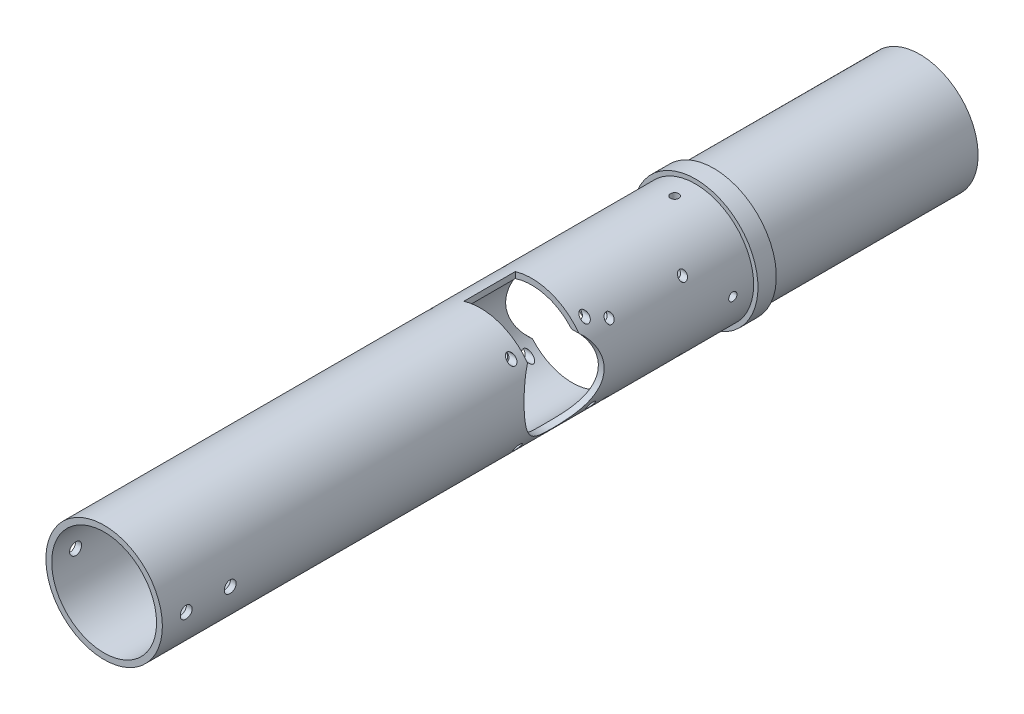
from build123d import *

# Parameters (mm, degrees)
BOSS_EXTRUDE1_DEPTH           = 125
BOSS_EXTRUDE1_DEPTH_BACK      = 250
SKETCH1_R                     = 31.75
SKETCH1_R_2                   = 28.575
SKETCH2_R                     = 21.75
CUT_EXTRUDE1_DEPTH            = 255.000246063
SKETCH3_R                     = 21.75
CUT_EXTRUDE2_DEPTH            = 255.000246187
CUT_EXTRUDE4_START            = 9
SKETCH5_W                     = 28
SKETCH5_H                     = 22
CUT_EXTRUDE4_DEPTH            = 264.000246187
CUT_EXTRUDE5_START            = -9
SKETCH6_W                     = 28
SKETCH6_H                     = 22
CUT_EXTRUDE5_DEPTH            = 264.000246187
CUT_EXTRUDE8_DEPTH            = 255.000246187
CUT_EXTRUDE8_DEPTH_BACK       = 255.000246187
SKETCH11_R                    = 2
CUT_EXTRUDE10_DEPTH           = 255.000246187
CUT_EXTRUDE10_DEPTH_BACK      = 255.000246187
SKETCH12_R                    = 3.25
CUT_EXTRUDE12_DEPTH           = 255.000246187
CUT_EXTRUDE12_DEPTH_BACK      = 255.000246187
SKETCH15_R                    = 2
SKETCH19_W                    = 2.25
SKETCH19_H                    = 31.75
M4_CLEARANCE_HOLE1_AT_2_COUNT = 2
M4_CLEARANCE_HOLE1_AT_2_PITCH = 40
M4_CLEARANCE_HOLE1_AT_3_COUNT = 2
M4_CLEARANCE_HOLE1_AT_3_PITCH = 40
M4_CLEARANCE_HOLE1_AT_4_COUNT = 2
M4_CLEARANCE_HOLE1_AT_4_PITCH = 56.568542495
M4_CLEARANCE_HOLE1_AT_5_COUNT = 2
M4_CLEARANCE_HOLE1_AT_5_PITCH = 90.126807577
M4_CLEARANCE_HOLE1_AT_6_COUNT = 2
M4_CLEARANCE_HOLE1_AT_6_PITCH = 50.197623888
M4_CLEARANCE_HOLE1_AT_7_COUNT = 2
M4_CLEARANCE_HOLE1_AT_7_PITCH = 100.213978286
M4_CLEARANCE_HOLE1_AT_8_COUNT = 2
M4_CLEARANCE_HOLE1_AT_8_PITCH = 66.631835064
MIRROR1_COPY_1_SKETCH_W       = 2.25
MIRROR1_COPY_1_SKETCH_H       = 31.75
MIRROR1_COPY_2_SKETCH_W       = 2.25
MIRROR1_COPY_2_SKETCH_H       = 31.75
MIRROR1_COPY_3_SKETCH_W       = 2.25
MIRROR1_COPY_3_SKETCH_H       = 31.75
MIRROR1_COPY_4_SKETCH_W       = 2.25
MIRROR1_COPY_4_SKETCH_H       = 31.75
MIRROR1_COPY_5_SKETCH_W       = 2.25
MIRROR1_COPY_5_SKETCH_H       = 31.75
MIRROR1_COPY_6_SKETCH_W       = 2.25
MIRROR1_COPY_6_SKETCH_H       = 31.75
MIRROR1_COPY_7_SKETCH_W       = 2.25
MIRROR1_COPY_7_SKETCH_H       = 31.75
SKETCH21_R                    = 30
CUT_EXTRUDE14_DEPTH           = 7
SKETCH22_R                    = 2.25
CUT_EXTRUDE15_DEPTH           = 255.000246187
SKETCH23_R                    = 30
SKETCH23_R_2                  = 28.575
BOSS_EXTRUDE2_DEPTH           = 7
CIRPATTERN2_COUNT             = 4
SKETCH24_R                    = 31.75
SKETCH24_R_2                  = 28.575
BOSS_EXTRUDE3_DEPTH           = 70.65
SKETCH25_R                    = 31.75
CUT_EXTRUDE16_DEPTH           = 1
BOSS_EXTRUDE4_START           = 10
SKETCH26_R                    = 34.1
SKETCH26_R_2                  = 31.75
BOSS_EXTRUDE4_DEPTH           = 10
BOSS_EXTRUDE5_START           = -10
SKETCH29_R                    = 28.575
SKETCH29_R_2                  = 21
BOSS_EXTRUDE5_DEPTH           = 10
M4X0_7_TAPPED_HOLE1_D         = 3.3
CIRPATTERN3_COUNT             = 8


with BuildPart() as part:
    # Sketch1 → Boss-Extrude1 (new, two sides: drawn at the far end of the back side and taken through both)
    with BuildSketch(Plane.XY.offset(-BOSS_EXTRUDE1_DEPTH_BACK)):
        Circle(SKETCH1_R)
        Circle(SKETCH1_R_2, mode=Mode.SUBTRACT)
    extrude(amount=BOSS_EXTRUDE1_DEPTH + BOSS_EXTRUDE1_DEPTH_BACK)

    # Sketch2 → Cut-Extrude1 (cut, through all)
    with BuildSketch(Plane(origin=(0, 0, 0), x_dir=(0, 0, -1), z_dir=(1, 0, 0))):
        with Locations((73.488, -2)):
            Circle(SKETCH2_R)
    extrude(amount=-CUT_EXTRUDE1_DEPTH, mode=Mode.SUBTRACT)

    # Sketch3 → Cut-Extrude2 (cut, through all)
    with BuildSketch(Plane(origin=(0, 0, 0), x_dir=(0, 0, -1), z_dir=(1, 0, 0))):
        with Locations(Location((23.45, 2, 0), (0, 0, 354.723969399))):
            Circle(SKETCH3_R)
    extrude(amount=CUT_EXTRUDE2_DEPTH, mode=Mode.SUBTRACT)

    # Sketch5 → Cut-Extrude4 (cut, through all)
    with BuildSketch(Plane(origin=(0, 0, 0), x_dir=(0, 0, -1), z_dir=(1, 0, 0)).offset(CUT_EXTRUDE4_START)):
        with Locations((73.488, -23.75)):
            Rectangle(SKETCH5_W, SKETCH5_H)
    extrude(amount=-CUT_EXTRUDE4_DEPTH, mode=Mode.SUBTRACT)

    # Sketch6 → Cut-Extrude5 (cut, through all)
    with BuildSketch(Plane(origin=(0, 0, 0), x_dir=(0, 0, -1), z_dir=(1, 0, 0)).offset(CUT_EXTRUDE5_START)):
        with Locations((23.45, 23.75)):
            Rectangle(SKETCH6_W, SKETCH6_H)
    extrude(amount=CUT_EXTRUDE5_DEPTH, mode=Mode.SUBTRACT)

    # Sketch11 → Cut-Extrude8 (cut, two sides: drawn at the far end of the back side and taken through both)
    with BuildSketch(Plane(origin=(0, 0, 0), x_dir=(0, 0, -1), z_dir=(1, 0, 0)).offset(-CUT_EXTRUDE8_DEPTH_BACK)):
        with Locations((93.488, 18)):
            Circle(SKETCH11_R)
        with Locations((53.488, 18)):
            Circle(SKETCH11_R)
        with Locations((53.488, -22)):
            Circle(SKETCH11_R)
        with Locations((93.488, -22)):
            Circle(SKETCH11_R)
    extrude(amount=CUT_EXTRUDE8_DEPTH + CUT_EXTRUDE8_DEPTH_BACK, mode=Mode.SUBTRACT)

    # Sketch12 → Cut-Extrude10 (cut, two sides: drawn at the far end of the back side and taken through both)
    with BuildSketch(Plane(origin=(0, 0, 0), x_dir=(0, 0, -1), z_dir=(1, 0, 0)).offset(-CUT_EXTRUDE10_DEPTH_BACK)):
        with Locations((-112, 0)):
            Circle(SKETCH12_R)
        with Locations((-88, 0)):
            Circle(SKETCH12_R)
    extrude(amount=CUT_EXTRUDE10_DEPTH + CUT_EXTRUDE10_DEPTH_BACK, mode=Mode.SUBTRACT)

    # Sketch15 → Cut-Extrude12 (cut, two sides: drawn at the far end of the back side and taken through both)
    with BuildSketch(Plane(origin=(0, 0, 0), x_dir=(0, 0, -1), z_dir=(1, 0, 0)).offset(-CUT_EXTRUDE12_DEPTH_BACK)):
        with Locations((3.45, 22)):
            Circle(SKETCH15_R)
        with Locations((43.45, 22)):
            Circle(SKETCH15_R)
        with Locations((43.45, -18)):
            Circle(SKETCH15_R)
        with Locations((3.45, -18)):
            Circle(SKETCH15_R)
    extrude(amount=CUT_EXTRUDE12_DEPTH + CUT_EXTRUDE12_DEPTH_BACK, mode=Mode.SUBTRACT)

    # Sketch19 → M4 Clearance Hole1 (revolve, cut)
    with BuildSketch(Plane(origin=(0, 22, -3.45), x_dir=(0, 0, 1), z_dir=(0, 1, 0))):
        with Locations((1.125, 15.875)):
            Rectangle(SKETCH19_W, SKETCH19_H)
    m4_clearance_hole1 = revolve(axis=Axis((-6.35, 22, -3.45), (1, 0, 0)), mode=Mode.SUBTRACT)

    # M4 Clearance Hole1 at 2: M4 Clearance Hole1 ×2
    with Locations(*[(0, 0, -i * M4_CLEARANCE_HOLE1_AT_2_PITCH) for i in range(1, M4_CLEARANCE_HOLE1_AT_2_COUNT)]):
        add(m4_clearance_hole1, mode=Mode.SUBTRACT)

    # M4 Clearance Hole1 at 3: M4 Clearance Hole1 ×2
    with Locations(*[(0, -i * M4_CLEARANCE_HOLE1_AT_3_PITCH, 0) for i in range(1, M4_CLEARANCE_HOLE1_AT_3_COUNT)]):
        add(m4_clearance_hole1, mode=Mode.SUBTRACT)

    # M4 Clearance Hole1 at 4: M4 Clearance Hole1 ×2
    with Locations(*[Vector(0, -0.7071067811865478, -0.7071067811865472) * (i * M4_CLEARANCE_HOLE1_AT_4_PITCH) for i in range(1, M4_CLEARANCE_HOLE1_AT_4_COUNT)]):
        add(m4_clearance_hole1, mode=Mode.SUBTRACT)

    # M4 Clearance Hole1 at 5: M4 Clearance Hole1 ×2
    with Locations(*[Vector(0, -0.04438191152602306, -0.9990146374950151) * (i * M4_CLEARANCE_HOLE1_AT_5_PITCH) for i in range(1, M4_CLEARANCE_HOLE1_AT_5_COUNT)]):
        add(m4_clearance_hole1, mode=Mode.SUBTRACT)

    # M4 Clearance Hole1 at 6: M4 Clearance Hole1 ×2
    with Locations(*[Vector(0, -0.07968504662542611, -0.9968200907607669) * (i * M4_CLEARANCE_HOLE1_AT_6_PITCH) for i in range(1, M4_CLEARANCE_HOLE1_AT_6_COUNT)]):
        add(m4_clearance_hole1, mode=Mode.SUBTRACT)

    # M4 Clearance Hole1 at 7: M4 Clearance Hole1 ×2
    with Locations(*[Vector(0, -0.43906050585303297, -0.8984574960453493) * (i * M4_CLEARANCE_HOLE1_AT_7_PITCH) for i in range(1, M4_CLEARANCE_HOLE1_AT_7_COUNT)]):
        add(m4_clearance_hole1, mode=Mode.SUBTRACT)

    # M4 Clearance Hole1 at 8: M4 Clearance Hole1 ×2
    with Locations(*[Vector(0, -0.6603450131265124, -0.7509623583369185) * (i * M4_CLEARANCE_HOLE1_AT_8_PITCH) for i in range(1, M4_CLEARANCE_HOLE1_AT_8_COUNT)]):
        add(m4_clearance_hole1, mode=Mode.SUBTRACT)

    # Mirror1: M4 Clearance Hole1 across plane
    add(m4_clearance_hole1.mirror(Plane(origin=(0, 0, 0), x_dir=(0, 0, 1), z_dir=(1, 0, 0))), mode=Mode.SUBTRACT)

    # Mirror1 copy 1 sketch → Mirror1 copy 1 (revolve, cut)
    with BuildSketch(Plane(origin=(0, 22, -43.45), x_dir=(0, 0, 1), z_dir=(0, 1, 0))):
        with Locations((1.125, -15.875)):
            Rectangle(MIRROR1_COPY_1_SKETCH_W, MIRROR1_COPY_1_SKETCH_H)
    revolve(axis=Axis((6.35, 22, -43.45), (1, 0, 0)), mode=Mode.SUBTRACT)

    # Mirror1 copy 2 sketch → Mirror1 copy 2 (revolve, cut)
    with BuildSketch(Plane(origin=(0, -18, -3.45), x_dir=(0, 0, 1), z_dir=(0, 1, 0))):
        with Locations((1.125, -15.875)):
            Rectangle(MIRROR1_COPY_2_SKETCH_W, MIRROR1_COPY_2_SKETCH_H)
    revolve(axis=Axis((6.35, -18, -3.45), (1, 0, 0)), mode=Mode.SUBTRACT)

    # Mirror1 copy 3 sketch → Mirror1 copy 3 (revolve, cut)
    with BuildSketch(Plane(origin=(0, -18, -43.45), x_dir=(0, 0, 1), z_dir=(0, 1, 0))):
        with Locations((1.125, -15.875)):
            Rectangle(MIRROR1_COPY_3_SKETCH_W, MIRROR1_COPY_3_SKETCH_H)
    revolve(axis=Axis((6.35, -18, -43.45), (1, 0, 0)), mode=Mode.SUBTRACT)

    # Mirror1 copy 4 sketch → Mirror1 copy 4 (revolve, cut)
    with BuildSketch(Plane(origin=(0, 18, -93.488), x_dir=(0, 0, 1), z_dir=(0, 1, 0))):
        with Locations((1.125, -15.875)):
            Rectangle(MIRROR1_COPY_4_SKETCH_W, MIRROR1_COPY_4_SKETCH_H)
    revolve(axis=Axis((6.35, 18, -93.488), (1, 0, 0)), mode=Mode.SUBTRACT)

    # Mirror1 copy 5 sketch → Mirror1 copy 5 (revolve, cut)
    with BuildSketch(Plane(origin=(0, 18, -53.488), x_dir=(0, 0, 1), z_dir=(0, 1, 0))):
        with Locations((1.125, -15.875)):
            Rectangle(MIRROR1_COPY_5_SKETCH_W, MIRROR1_COPY_5_SKETCH_H)
    revolve(axis=Axis((6.35, 18, -53.488), (1, 0, 0)), mode=Mode.SUBTRACT)

    # Mirror1 copy 6 sketch → Mirror1 copy 6 (revolve, cut)
    with BuildSketch(Plane(origin=(0, -22, -93.488), x_dir=(0, 0, 1), z_dir=(0, 1, 0))):
        with Locations((1.125, -15.875)):
            Rectangle(MIRROR1_COPY_6_SKETCH_W, MIRROR1_COPY_6_SKETCH_H)
    revolve(axis=Axis((6.35, -22, -93.488), (1, 0, 0)), mode=Mode.SUBTRACT)

    # Mirror1 copy 7 sketch → Mirror1 copy 7 (revolve, cut)
    with BuildSketch(Plane(origin=(0, -22, -53.488), x_dir=(0, 0, 1), z_dir=(0, 1, 0))):
        with Locations((1.125, -15.875)):
            Rectangle(MIRROR1_COPY_7_SKETCH_W, MIRROR1_COPY_7_SKETCH_H)
    revolve(axis=Axis((6.35, -22, -53.488), (1, 0, 0)), mode=Mode.SUBTRACT)

    # Sketch21 → Cut-Extrude14 (cut)
    with BuildSketch(Plane(origin=(0, 0, -250), x_dir=(-1, 0, 0), z_dir=(0, 0, -1))):
        Circle(SKETCH21_R)
    extrude(amount=-CUT_EXTRUDE14_DEPTH, mode=Mode.SUBTRACT)

    # Sketch22 → Cut-Extrude15 (cut, through all)
    with BuildSketch(Plane(origin=(0, 0, 0), x_dir=(0, 0, -1), z_dir=(1, 0, 0))):
        with Locations(Location((115.3, 0, 0), (0, 0, 180))):
            Circle(SKETCH22_R)
    cut_extrude15 = extrude(amount=CUT_EXTRUDE15_DEPTH, mode=Mode.SUBTRACT)

    # Sketch23 → Boss-Extrude2 (add)
    with BuildSketch(Plane(origin=(0, 0, -243), x_dir=(-1, 0, 0), z_dir=(0, 0, -1))):
        Circle(SKETCH23_R)
        with Locations(Location((0, 0, 0), (0, 0, 180))):
            Circle(SKETCH23_R_2, mode=Mode.SUBTRACT)
    extrude(amount=BOSS_EXTRUDE2_DEPTH)

    # CirPattern2: Cut-Extrude15 ×4 about axis
    cirpattern2_axis = Axis((0, 0, -250), (0, 0, 1))
    for i in range(1, CIRPATTERN2_COUNT):
        add(cut_extrude15.rotate(cirpattern2_axis, i * 360 / CIRPATTERN2_COUNT), mode=Mode.SUBTRACT)


with BuildPart() as body_2:
    # Split1: the piece on the far side of the plane
    add(part.part)
    split(bisect_by=Plane.XY.offset(75), keep=Keep.BOTTOM)


with BuildPart() as part_1:
    add(part.part)

    # Split1
    split(bisect_by=Plane.XY.offset(75), keep=Keep.TOP)


with BuildPart() as part_2:
    # Body-Move/Copy1: moved
    add(part_1.part.moved(Location((0, 0, 70.65))))


    add(body_2.part)  # Boss-Extrude3 merges body 2
    # Sketch24 → Boss-Extrude3 (add)
    with BuildSketch(Plane.XY.offset(75)):
        Circle(SKETCH24_R)
        Circle(SKETCH24_R_2, mode=Mode.SUBTRACT)
    extrude(amount=BOSS_EXTRUDE3_DEPTH)

    # Sketch25 → Cut-Extrude16 (cut)
    with BuildSketch(Plane(origin=(0, 0, -250), x_dir=(-1, 0, 0), z_dir=(0, 0, -1))):
        with Locations(Location((0, 0, 0), (0, 0, 180))):
            Circle(SKETCH25_R)
    extrude(amount=-CUT_EXTRUDE16_DEPTH, mode=Mode.SUBTRACT)

    # Sketch26 → Boss-Extrude4 (add)
    with BuildSketch(Plane(origin=(0, 0, -126.65), x_dir=(-1, 0, 0), z_dir=(0, 0, -1)).offset(BOSS_EXTRUDE4_START)):
        Circle(SKETCH26_R)
        with Locations(Location((0, 0, 0), (0, 0, 180))):
            Circle(SKETCH26_R_2, mode=Mode.SUBTRACT)
    extrude(amount=-BOSS_EXTRUDE4_DEPTH)

    # Sketch29 → Boss-Extrude5 (add)
    with BuildSketch(Plane(origin=(0, 0, -249), x_dir=(-1, 0, 0), z_dir=(0, 0, -1)).offset(BOSS_EXTRUDE5_START)):
        with Locations(Location((0, 0, 0), (0, 0, 180))):
            Circle(SKETCH29_R)
        Circle(SKETCH29_R_2, mode=Mode.SUBTRACT)
    extrude(amount=BOSS_EXTRUDE5_DEPTH)

    # M4x0.7 Tapped Hole1 (through all)
    with Locations(Plane(origin=(0, 0, -249), x_dir=(-1, 0, 0), z_dir=(0, 0, -1))):
        with Locations((0, 24.75)):
            m4x0_7_tapped_hole1 = Hole(M4X0_7_TAPPED_HOLE1_D / 2)

    # CirPattern3: M4x0.7 Tapped Hole1 ×8 about axis
    cirpattern3_axis = Axis((0, 0, 0), (0, 0, 1))
    for i in range(1, CIRPATTERN3_COUNT):
        add(m4x0_7_tapped_hole1.rotate(cirpattern3_axis, i * 360 / CIRPATTERN3_COUNT), mode=Mode.SUBTRACT)


solid = part_2.part
